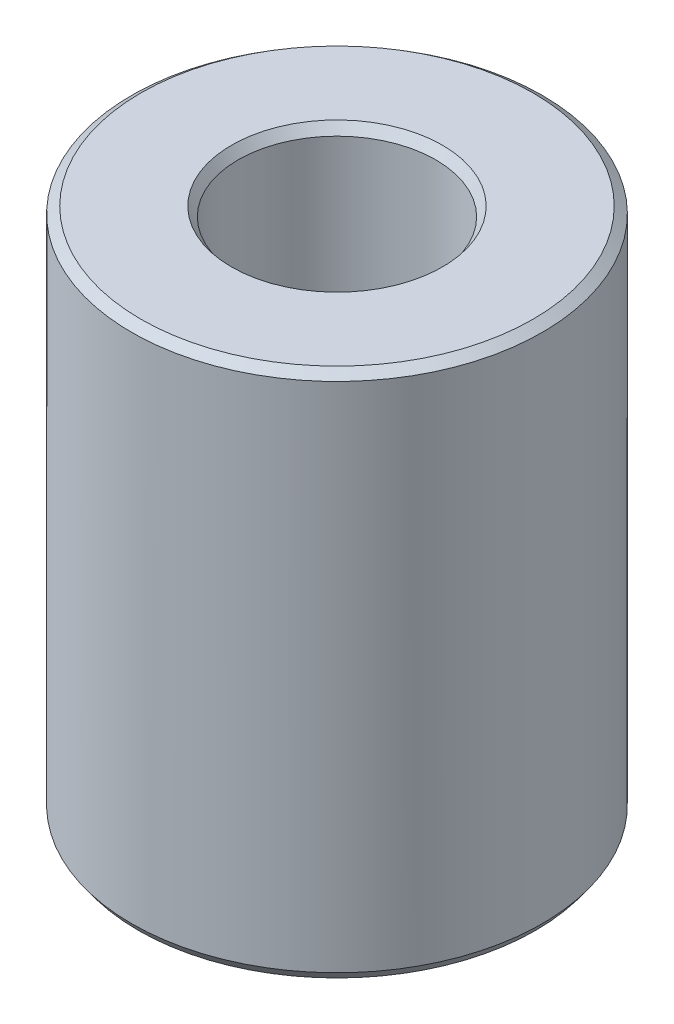
from build123d import *
from OCP.BRepFilletAPI import BRepFilletAPI_MakeChamfer

# Parameters (mm, degrees)
SKETCH1_R           = 10
BOSS_EXTRUDE1_DEPTH = 25.718960043
SKETCH2_R           = 4.810278903
CUT_EXTRUDE1_DEPTH  = 30.350722405
CHAMFER1_SIZE       = 0.327811261
CHAMFER1_SIZE2      = 0.451935568


with BuildPart() as part:
    # Sketch1 → Boss-Extrude1 (new body)
    with BuildSketch(Plane(origin=(0, 0, 0), x_dir=(1, 0, 0), z_dir=(0, 1, 0))):
        Circle(SKETCH1_R)
    extrude(amount=BOSS_EXTRUDE1_DEPTH)

    # Sketch2 → Cut-Extrude1 (cut, through all)
    with BuildSketch(Plane(origin=(0, 0, 0), x_dir=(1, 0, 0), z_dir=(0, 1, 0))):
        Circle(SKETCH2_R)
    extrude(amount=CUT_EXTRUDE1_DEPTH, mode=Mode.SUBTRACT)

    # Chamfer1: one chamfer whose edges measure the first distance from different faces: ONE call of the kernel's chamfer builder (chamfer() names one face for all edges)
    chamfer1_edges_1 = [part.edges().sort_by_distance(p)[0] for p in [
        (-4.810278903, 25.718960043, 0),
    ]]
    chamfer1_side_1 = [part.faces().sort_by_distance(p)[0] for p in [
        (-9.717157288, 25.718960043, 0),
    ]]
    chamfer1_edges_2 = [part.edges().sort_by_distance(p)[0] for p in [
        (-4.810278903, 0, 0),
    ]]
    chamfer1_side_2 = [part.faces().sort_by_distance(p)[0] for p in [
        (-4.810278903, 12.859480021, 0),
    ]]
    chamfer1_edges_3 = [part.edges().sort_by_distance(p)[0] for p in [
        (-10, 0, 0),
    ]]
    chamfer1_side_3 = [part.faces().sort_by_distance(p)[0] for p in [
        (-9.717157288, 0, 0),
    ]]
    chamfer1_edges_4 = [part.edges().sort_by_distance(p)[0] for p in [
        (-10, 25.718960043, 0),
    ]]
    chamfer1_side_4 = [part.faces().sort_by_distance(p)[0] for p in [
        (-10, 12.859480021, 0),
    ]]
    chamfer1 = BRepFilletAPI_MakeChamfer(part.part.solid().wrapped)
    for e in chamfer1_edges_1:
        chamfer1.Add(CHAMFER1_SIZE, CHAMFER1_SIZE2, e.wrapped, chamfer1_side_1[0].wrapped)  # the first distance lies on this face
    for e in chamfer1_edges_2:
        chamfer1.Add(CHAMFER1_SIZE, CHAMFER1_SIZE2, e.wrapped, chamfer1_side_2[0].wrapped)  # the first distance lies on this face
    for e in chamfer1_edges_3:
        chamfer1.Add(CHAMFER1_SIZE, CHAMFER1_SIZE2, e.wrapped, chamfer1_side_3[0].wrapped)  # the first distance lies on this face
    for e in chamfer1_edges_4:
        chamfer1.Add(CHAMFER1_SIZE, CHAMFER1_SIZE2, e.wrapped, chamfer1_side_4[0].wrapped)  # the first distance lies on this face
    add(Compound.cast(chamfer1.Shape()), mode=Mode.REPLACE)


solid = part.part
